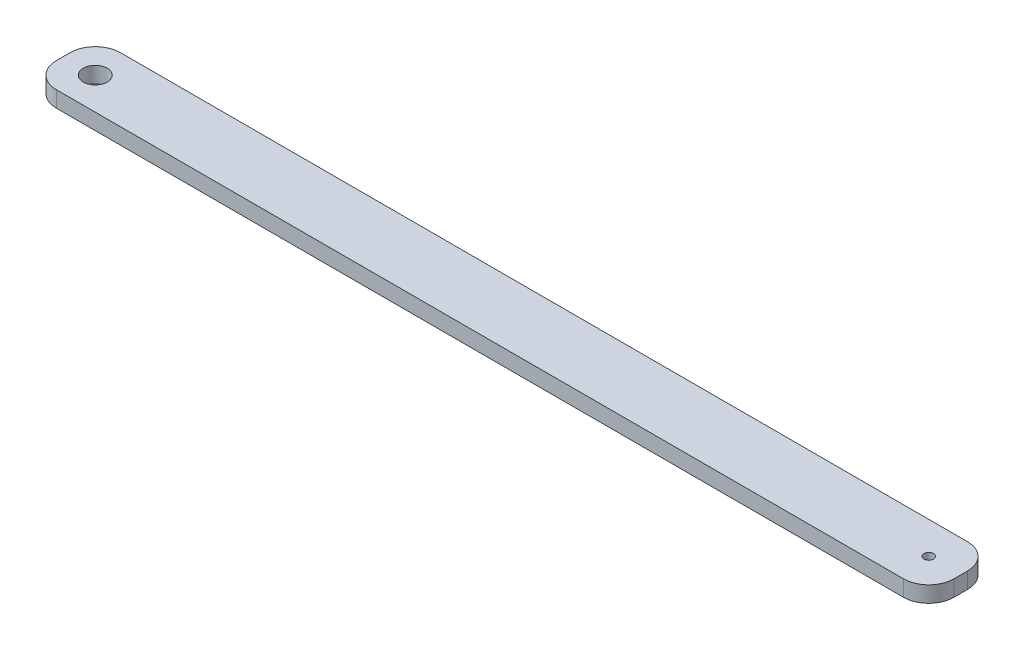
from build123d import *

# Parameters (mm, degrees)
SKETCH1_W              = 355.6
SKETCH1_H              = 25.4
BOSS_EXTRUDE1_DEPTH    = 3.175
FILLET1_R              = 10
F_10_24_TAPPED_HOLE1_D = 3.7973
SKETCH8_R              = 4.7625
CUT_EXTRUDE1_DEPTH     = 179.366063196


with BuildPart() as part:
    # Sketch1 → Boss-Extrude1 (new, symmetric)
    with BuildSketch(Plane(origin=(0, 0, 0), x_dir=(1, 0, 0), z_dir=(0, 1, 0))):
        Rectangle(SKETCH1_W, SKETCH1_H)
    extrude(amount=BOSS_EXTRUDE1_DEPTH, both=True)

    # Fillet1
    fillet1_edges = [part.edges().sort_by_distance(p)[0] for p in [
        (177.8, 0, -12.7),
        (177.8, 0, 12.7),
        (-177.8, 0, -12.7),
        (-177.8, 0, 12.7),
    ]]
    fillet(fillet1_edges, radius=FILLET1_R)

    # #10-24 Tapped Hole1 (through all)
    with Locations(Plane(origin=(0, 3.175, 0), x_dir=(1, 0, 0), z_dir=(0, 1, 0))):
        with Locations((165.1, 0)):
            Hole(F_10_24_TAPPED_HOLE1_D / 2)

    # Sketch8 → Cut-Extrude1 (cut, through all)
    with BuildSketch(Plane(origin=(0, 3.175, 0), x_dir=(1, 0, 0), z_dir=(0, 1, 0))):
        with Locations((-165.1, 0)):
            Circle(SKETCH8_R)
    extrude(amount=-CUT_EXTRUDE1_DEPTH, mode=Mode.SUBTRACT)


solid = part.part
